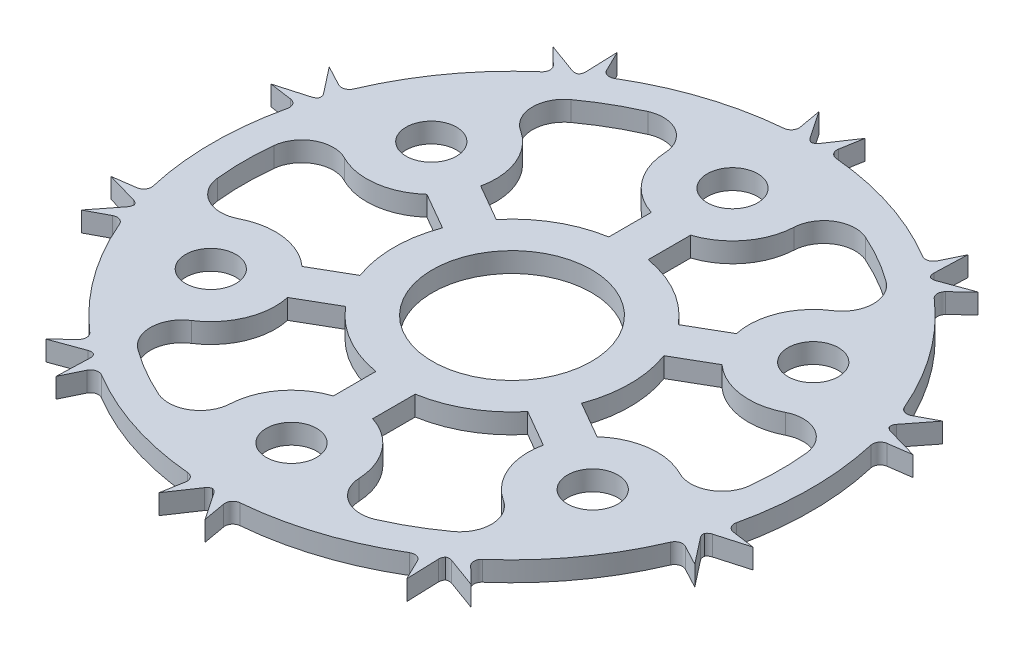
from build123d import *
from build123d.topology import SkipClean

# Parameters (mm, degrees)
SKETCH1_R                = 25.4
BOSS_EXTRUDE1_DEPTH      = 7.62
CUT_EXTRUDE4_DEPTH       = 0.635
CIRPATTERN2_COUNT        = 20
BOSS_EXTRUDE2_REACH      = 36.931
SKETCH5_R                = 3.81
SKETCH5_R_2              = 1.397
BOSS_EXTRUDE6_REACH      = 36.931
SKETCH12_R               = 3.81
SKETCH17_R               = 1.397
CUT_EXTRUDE5_DEPTH       = 33.341392346
CIRPATTERN1_COUNT        = 3
CUT_EXTRUDE7_DEPTH       = 33.67002223
SKETCH30_R               = 24.13
SKETCH30_R_2             = 21.59
BOSS_EXTRUDE16_DEPTH     = 1.6002
SKETCH31_R               = 2.032
BOSS_EXTRUDE17_DEPTH     = 1.6002
FILLET6_R                = 2.54
CIRPATTERN8_COUNT        = 6
FILLET6_OF_CIRPATTERN8_R = 2.54
BOSS_EXTRUDE18_DEPTH     = 1.6002
FILLET7_R                = 0.635
CIRPATTERN9_COUNT        = 10
FILLET7_OF_CIRPATTERN9_R = 0.635
SKETCH34_R               = 9.525
SKETCH34_R_2             = 6.4135
BOSS_EXTRUDE19_DEPTH     = 1.6002


with BuildPart() as part:
    # Sketch1 → Boss-Extrude1 (new, symmetric)
    with BuildSketch(Plane(origin=(0, 0, 0), x_dir=(1, 0, 0), z_dir=(0, 1, 0))):
        with Locations(Location((0, 0, 0), (0, 0, 90))):
            Circle(SKETCH1_R)
    extrude(amount=BOSS_EXTRUDE1_DEPTH, both=True)

    # Sketch9 → Cut-Extrude4 (cut)
    with BuildSketch(Plane.ZY.offset(25.4)):
        Polygon((-0.635, -7.62), (0.635, -7.62), (0.635, 0), (0.635, 7.62), (-0.635, 7.62), (-0.635, 0), align=None)
    cut_extrude4 = extrude(amount=-CUT_EXTRUDE4_DEPTH, mode=Mode.SUBTRACT)

    # CirPattern2: Cut-Extrude4 ×20 about axis
    cirpattern2_axis = Axis((0, 0, 0), (0, 1, 0))
    for i in range(1, CIRPATTERN2_COUNT):
        add(cut_extrude4.rotate(cirpattern2_axis, i * 360 / CIRPATTERN2_COUNT), mode=Mode.SUBTRACT)

    # Sketch4 → Cut-Revolve2 (revolve, cut)
    with BuildSketch(Plane.XY, mode=Mode.PRIVATE) as cut_revolve2_sk:
        with BuildLine():
            Line((-25.4, -7.62), (-22.225, -7.62))
            Line((-22.225, -7.62), (-22.225, -5.08))
            Line((-22.225, -5.08), (-13.94687024, -1.768748096))
            ThreePointArc((-13.94687024, -1.768748096), (-12.749369479, 0), (-13.94687024, 1.768748096))
            Line((-13.94687024, 1.768748096), (-22.225, 5.08))
            Line((-22.225, 5.08), (-22.225, 7.62))
            Line((-22.225, 7.62), (-25.4, 7.62))
            Line((-25.4, 7.62), (-25.4, -7.62))
        make_face()
    revolve(cut_revolve2_sk.sketch.rotate(Axis((0, -55, 0), (0, 1, 0)), 270), axis=Axis((0, -55, 0), (0, 1, 0)), mode=Mode.SUBTRACT)

    # Sketch5 → Boss-Extrude2 (add, up to next)
    with BuildSketch(Plane(origin=(0, 7.62, 0), x_dir=(1, 0, 0), z_dir=(0, 1, 0)), mode=Mode.PRIVATE) as boss_extrude2_sk1:
        with Locations(Location((0, 17.78, 0), (0, 0, 135.677409987))):
            Circle(SKETCH5_R)
        with Locations(Location((0, 17.78, 0), (0, 0, 168.148952206))):
            Circle(SKETCH5_R_2, mode=Mode.SUBTRACT)
    boss_extrude2_tool1 = extrude(boss_extrude2_sk1.sketch, amount=-BOSS_EXTRUDE2_REACH, mode=Mode.PRIVATE) - part.part
    boss_extrude2 = boss_extrude2_tool1.solids().sort_by_distance((2.648644, 7.62, -15.193257))[0]
    add(boss_extrude2)

    # Sketch12 → Boss-Extrude6 (add, up to next)
    with BuildSketch(Plane(origin=(0, 7.62, 0), x_dir=(1, 0, 0), z_dir=(0, 1, 0)), mode=Mode.PRIVATE) as boss_extrude6_sk1:
        with Locations(Location((-15.397931679, 8.89, 0), (0, 0, 134.328577967))):
            Circle(SKETCH12_R)
    boss_extrude6_tool1 = extrude(boss_extrude6_sk1.sketch, amount=-BOSS_EXTRUDE6_REACH, mode=Mode.PRIVATE) - part.part
    boss_extrude6 = boss_extrude6_tool1.solids().sort_by_distance((-15.397932, 7.62, -8.89))[0]
    add(boss_extrude6)

    # Sketch17 → Cut-Extrude5 (cut, symmetric)
    with BuildSketch(Plane(origin=(0, 0, 0), x_dir=(1, 0, 0), z_dir=(0, 1, 0))):
        with Locations(Location((0, 17.78, 0), (0, 0, 270))):
            Circle(SKETCH17_R)
        with Locations(Location((-15.397931679, 8.89, 0), (0, 0, 270))):
            Circle(SKETCH17_R)
        with Locations(Location((-15.397931679, -8.89, 0), (0, 0, 270))):
            Circle(SKETCH17_R)
        with BuildLine():
            Line((-18.697488468, -10.795), (-19.247414599, -11.1125))
            ThreePointArc((-19.247414599, -11.1125), (-19.247414599, 11.1125), (0, 22.225))
            Line((0, 22.225), (0, 21.59))
            ThreePointArc((0, 21.59), (-2.694076836, 20.474076836), (-3.81, 17.78))
            Line((-3.81, 17.78), (-3.81, 15.411019596))
            ThreePointArc((-3.81, 15.411019596), (-7.9375, 13.748153285), (-11.441334469, 11.005066587))
            Line((-11.441334469, 11.005066587), (-13.492931679, 12.189556788))
            ThreePointArc((-13.492931679, 12.189556788), (-18.697488468, 10.795), (-17.302931679, 5.590443212))
            Line((-17.302931679, 5.590443212), (-15.251334469, 4.40595301))
            ThreePointArc((-15.251334469, 4.40595301), (-15.875, 0), (-15.251334469, -4.40595301))
            Line((-15.251334469, -4.40595301), (-17.302931679, -5.590443212))
            ThreePointArc((-17.302931679, -5.590443212), (-19.078109077, -7.903899438), (-18.697488468, -10.795))
        make_face()
    cut_extrude5 = extrude(amount=CUT_EXTRUDE5_DEPTH, both=True, mode=Mode.SUBTRACT)

    # CirPattern1: Boss-Extrude2, Boss-Extrude6, Cut-Extrude5 ×3 about axis
    with SkipClean():  # the faces are left unmerged after this step: merging them gives an invalid solid
        cirpattern1_axis = Axis((0, 0, 0), (0, 1, 0))
        add([boss_extrude2.rotate(cirpattern1_axis, i * 360 / CIRPATTERN1_COUNT) for i in range(1, CIRPATTERN1_COUNT)])
        add([boss_extrude6.rotate(cirpattern1_axis, i * 360 / CIRPATTERN1_COUNT) for i in range(1, CIRPATTERN1_COUNT)])
        add([cut_extrude5.rotate(cirpattern1_axis, i * 360 / CIRPATTERN1_COUNT) for i in range(1, CIRPATTERN1_COUNT)], mode=Mode.SUBTRACT)

    # Sketch24 → Cut-Extrude7 (cut, through all)
    with BuildSketch(Plane.XZ.offset(7.62)):
        Polygon((5.499261314, -9.525), (10.998522628, 0), (5.499261314, 9.525), (-5.499261314, 9.525), (-10.998522628, 0), (-5.499261314, -9.525), align=None)
    extrude(amount=-CUT_EXTRUDE7_DEPTH, mode=Mode.SUBTRACT)


with BuildPart() as body_2:
    # Sketch30 → Boss-Extrude16 (new body)
    with BuildSketch(Plane.XZ.offset(7.62)):
        with Locations(Location((0, 0, 0), (0, 0, 270))):
            Circle(SKETCH30_R)
        with Locations(Location((0, 0, 0), (0, 0, 270))):
            Circle(SKETCH30_R_2, mode=Mode.SUBTRACT)
    extrude(amount=BOSS_EXTRUDE16_DEPTH)

    # Sketch31 → Boss-Extrude17 (add)
    with BuildSketch(Plane.XZ.offset(9.2202)):
        with BuildLine():
            Line((-5.207, 17.78), (-5.207, 23.561495093))
            Line((-5.207, 23.561495093), (5.207, 23.561495093))
            Line((5.207, 23.561495093), (5.207, 17.78))
            ThreePointArc((5.207, 17.78), (4.20588644, 14.710249481), (1.5875, 12.82089799))
            Line((1.5875, 12.82089799), (1.5875, 7.62))
            Line((1.5875, 7.62), (-1.5875, 7.62))
            Line((-1.5875, 7.62), (-1.5875, 12.82089799))
            ThreePointArc((-1.5875, 12.82089799), (-4.20588644, 14.710249481), (-5.207, 17.78))
        make_face()
        with Locations(Location((0, 17.78, 0), (0, 0, 270))):
            Circle(SKETCH31_R, mode=Mode.SUBTRACT)
    boss_extrude17 = extrude(amount=-BOSS_EXTRUDE17_DEPTH)

    # Fillet6
    fillet6_edges = [body_2.edges().sort_by_distance(p)[0] for p in [
        (5.207, -8.4201, 20.952690782),
        (-5.207, -8.4201, 20.952690782),
    ]]
    fillet(fillet6_edges, radius=FILLET6_R)

    # CirPattern8: Boss-Extrude17 ×6 about axis
    cirpattern8_axis = Axis((0, 0, 0), (0, 1, 0))
    for i in range(1, CIRPATTERN8_COUNT):
        add(boss_extrude17.rotate(cirpattern8_axis, i * 360 / CIRPATTERN8_COUNT))

    # Fillet6 of CirPattern8
    fillet6_of_cirpattern8_edges = [body_2.edges().sort_by_distance(p)[0] for p in [
        (20.749062495, -8.4201, 5.966951113),
        (15.542062495, -8.4201, 14.985739668),
        (15.542062495, -8.4201, -14.985739668),
        (20.749062495, -8.4201, -5.966951113),
        (-5.207, -8.4201, -20.952690782),
        (5.207, -8.4201, -20.952690782),
        (-20.749062495, -8.4201, -5.966951113),
        (-15.542062495, -8.4201, -14.985739668),
        (-15.542062495, -8.4201, 14.985739668),
        (-20.749062495, -8.4201, 5.966951113),
    ]]
    fillet(fillet6_of_cirpattern8_edges, radius=FILLET6_OF_CIRPATTERN8_R)

    # Sketch32 → Boss-Extrude18 (add)
    with BuildSketch(Plane.XZ.offset(9.2202)):
        Polygon((1.860405155, 26.60503322), (0.190467123, 24.129248274), (1.416651103, 24.088378934), align=None)
        Polygon((-1.416651103, 24.088378934), (-1.860405155, 26.60503322), (-0.190467123, 24.129248274), align=None)
    boss_extrude18 = extrude(amount=-BOSS_EXTRUDE18_DEPTH)

    # Fillet7
    # the kernel refuses this fillet: 0.635 mm, written as the material it adds along each edge
    with BuildSketch(Plane(origin=(-0.190467123, -9.2202, 24.129248274), x_dir=(0.9999995200817018, 0, 0.0009797123894977819), z_dir=(0, 1, 0))) as fillet7_piece_1:
        with BuildLine():
            CenterArc((0.338044808, -0.634984824), FILLET7_R, 90.396128338, 55.660005056)
            Line((-0.188741682, -0.280413259), (0, 0))
            ThreePointArc((0, 0), (0.166827308, -0.000576703), (0.333654615, 0))
        make_face()
    extrude(amount=1.6002)
    with BuildSketch(Plane(origin=(-1.416651103, -9.2202, 24.088378934), x_dir=(-0.9973280009375803, 0, -0.07305380582727858), z_dir=(0, 1, 0))) as fillet7_piece_2:
        with BuildLine():
            CenterArc((0.702892362, 0.634934383), FILLET7_R, 174.18940678, 94.986906687)
            Line((0.071154987, 0.699221933), (0, 0))
            ThreePointArc((0, 0), (0.346881945, 0.002493438), (0.69376389, 0))
        make_face()
    extrude(amount=1.6002)
    with BuildSketch(Plane(origin=(1.416651103, -9.2202, 24.088378934), x_dir=(0.9973280009375803, 0, -0.07305380582727927), z_dir=(0, 1, 0))) as fillet7_piece_3:
        with BuildLine():
            CenterArc((0.702892362, -0.634934383), FILLET7_R, 90.823686533, 94.986906687)
            Line((0.071154987, -0.699221933), (0, 0))
            ThreePointArc((0, 0), (0.346881945, -0.002493438), (0.69376389, 0))
        make_face()
    extrude(amount=1.6002)
    with BuildSketch(Plane(origin=(0.190467123, -9.2202, 24.129248274), x_dir=(-0.9999995200817018, 0, 0.0009797123894977626), z_dir=(0, 1, 0))) as fillet7_piece_4:
        with BuildLine():
            CenterArc((0.338044808, 0.634984824), FILLET7_R, 213.943866606, 55.660005056)
            Line((-0.188741682, 0.280413259), (0, 0))
            ThreePointArc((0, 0), (0.166827308, 0.000576703), (0.333654615, 0))
        make_face()
    extrude(amount=1.6002)

    # CirPattern9: Boss-Extrude18 ×10 about axis
    cirpattern9_axis = Axis((0, 0, 0), (0, 1, 0))
    for i in range(1, CIRPATTERN9_COUNT):
        add(boss_extrude18.rotate(cirpattern9_axis, i * 360 / CIRPATTERN9_COUNT))

    # Fillet7 of CirPattern9
    # the kernel refuses this fillet: 0.635 mm, written as the material it adds along each edge
    with BuildSketch(Plane(origin=(14.028725145, -9.2202, 19.632925681), x_dir=(0.03489949670250677, 0, 0.9993908270190954), z_dir=(0, 1, 0)), Plane(origin=(22.889421227, -9.2202, 7.637492776), x_dir=(0.615661475325664, 0, 0.7880107536067176), z_dir=(0, 1, 0)), Plane(origin=(23.007136382, -9.2202, -7.27520278), x_dir=(0.9612616959383196, 0, 0.27563735581699683), z_dir=(0, 1, 0)), Plane(origin=(14.336907424, -9.2202, -19.40901815), x_dir=(0.9396926207859054, 0, -0.34202014332567665), z_dir=(0, 1, 0)), Plane(origin=(0.190467123, -9.2202, -24.129248274), x_dir=(0.559192903470741, 0, -0.8290375725550456), z_dir=(0, 1, 0)), Plane(origin=(-14.028725145, -9.2202, -19.632925681), x_dir=(-0.03489949670250263, 0, -0.9993908270190958), z_dir=(0, 1, 0)), Plane(origin=(-22.889421227, -9.2202, -7.637492776), x_dir=(-0.6156614753256622, 0, -0.7880107536067188), z_dir=(0, 1, 0)), Plane(origin=(-23.007136382, -9.2202, 7.27520278), x_dir=(-0.9612616959383196, 0, -0.27563735581699694), z_dir=(0, 1, 0))) as fillet7_of_cirpattern9_piece_1:
        with BuildLine():
            CenterArc((0.338016299, 0.635), FILLET7_OF_CIRPATTERN9_R, 214.339994944, 55.660005056)
            ThreePointArc((-0.186306203, 0.276794872), (-0.092674677, 0.138719456), (0, 0))
            Line((0, 0), (0.338016299, 0))
        make_face()
    extrude(amount=1.6002)
    with BuildSketch(Plane(origin=(13.012699072, -9.2202, 20.32059455), x_dir=(-0.8497952514136049, 0, 0.527112920231413), z_dir=(0, 1, 0)), Plane(origin=(22.471640486, -9.2202, 8.79103372), x_dir=(-0.37766959932788574, 0, 0.9259404266709139), z_dir=(0, 1, 0)), Plane(origin=(23.347179018, -9.2202, -6.096403195), x_dir=(0.23871300318352556, 0, 0.9710901616796981), z_dir=(0, 1, 0)), Plane(origin=(15.304888706, -9.2202, -18.655221298), x_dir=(0.7639153520353841, 0, 0.6453164610674791), z_dir=(0, 1, 0)), Plane(origin=(1.416651103, -9.2202, -24.088378934), x_dir=(0.9973280009375805, 0, 0.07305380582727697), z_dir=(0, 1, 0)), Plane(origin=(-13.012699072, -9.2202, -20.32059455), x_dir=(0.8497952514136128, 0, -0.5271129202314003), z_dir=(0, 1, 0)), Plane(origin=(-22.471640486, -9.2202, -8.79103372), x_dir=(0.37766959932791355, 0, -0.9259404266709027), z_dir=(0, 1, 0)), Plane(origin=(-23.347179018, -9.2202, 6.096403195), x_dir=(-0.23871300318349162, 0, -0.9710901616797064), z_dir=(0, 1, 0)), Plane(origin=(-15.304888706, -9.2202, 18.655221298), x_dir=(-0.7639153520353762, 0, -0.6453164610674884), z_dir=(0, 1, 0))) as fillet7_of_cirpattern9_piece_2:
        with BuildLine():
            CenterArc((0.702892362, 0.634934383), FILLET7_OF_CIRPATTERN9_R, 174.18940678, 94.986906687)
            Line((0.071154987, 0.699221933), (0, 0))
            ThreePointArc((0, 0), (0.346881945, 0.002493438), (0.69376389, 0))
        make_face()
    extrude(amount=1.6002)
    with BuildSketch(Plane(origin=(15.304888706, -9.2202, 18.655221298), x_dir=(0.7193398003386516, 0, 0.6946583704589967), z_dir=(0, 1, 0)), Plane(origin=(23.347179018, -9.2202, 6.096403195), x_dir=(0.9902680687415706, 0, 0.13917310096006394), z_dir=(0, 1, 0)), Plane(origin=(22.471640486, -9.2202, -8.79103372), x_dir=(0.8829475928589268, 0, -0.46947156278589125), z_dir=(0, 1, 0)), Plane(origin=(13.012699072, -9.2202, -20.32059455), x_dir=(0.4383711467890756, 0, -0.8987940462991678), z_dir=(0, 1, 0)), Plane(origin=(-1.416651103, -9.2202, -24.088378934), x_dir=(-0.17364817766693175, 0, -0.9848077530122078), z_dir=(0, 1, 0)), Plane(origin=(-15.304888706, -9.2202, -18.655221298), x_dir=(-0.7193398003386523, 0, -0.6946583704589961), z_dir=(0, 1, 0)), Plane(origin=(-23.347179018, -9.2202, -6.096403195), x_dir=(-0.9902680687415706, 0, -0.13917310096006316), z_dir=(0, 1, 0)), Plane(origin=(-22.471640486, -9.2202, 8.79103372), x_dir=(-0.8829475928589264, 0, 0.46947156278589175), z_dir=(0, 1, 0))) as fillet7_of_cirpattern9_piece_3:
        with BuildLine():
            CenterArc((0.702833084, 0.635), FILLET7_OF_CIRPATTERN9_R, 175.013093313, 94.986906687)
            ThreePointArc((0.07023682, 0.690199336), (0.037599036, 0.344847232), (0, 0))
            Line((0, 0), (0.702833084, 0))
        make_face()
    extrude(amount=1.6002)
    with BuildSketch(Plane(origin=(14.336907424, -9.2202, 19.40901815), x_dir=(-0.8084407456188444, 0, 0.5885775741762905), z_dir=(0, 1, 0)), Plane(origin=(23.007136382, -9.2202, 7.27520278), x_dir=(-0.3080850842198965, 0, 0.9513588076436879), z_dir=(0, 1, 0)), Plane(origin=(22.889421227, -9.2202, -7.637492776), x_dir=(0.30994860792420126, 0, 0.9507533120877623), z_dir=(0, 1, 0)), Plane(origin=(14.028725145, -9.2202, -19.632925681), x_dir=(0.8095924666069352, 0, 0.5869923662308553), z_dir=(0, 1, 0)), Plane(origin=(-0.190467123, -9.2202, -24.129248274), x_dir=(0.9999995200817018, 0, -0.000979712389497761), z_dir=(0, 1, 0)), Plane(origin=(-14.336907424, -9.2202, -19.40901815), x_dir=(0.8084407456188637, 0, -0.588577574176264), z_dir=(0, 1, 0)), Plane(origin=(-23.007136382, -9.2202, -7.27520278), x_dir=(0.30808508421995306, 0, -0.9513588076436695), z_dir=(0, 1, 0)), Plane(origin=(-22.889421227, -9.2202, 7.637492776), x_dir=(-0.30994860792414214, 0, -0.9507533120877815), z_dir=(0, 1, 0)), Plane(origin=(-14.028725145, -9.2202, 19.632925681), x_dir=(-0.8095924666069085, 0, -0.5869923662308921), z_dir=(0, 1, 0))) as fillet7_of_cirpattern9_piece_4:
        with BuildLine():
            CenterArc((0.338044808, 0.634984824), FILLET7_OF_CIRPATTERN9_R, 213.943866606, 55.660005056)
            Line((-0.188741682, 0.280413259), (0, 0))
            ThreePointArc((0, 0), (0.166827308, 0.000576703), (0.333654615, 0))
        make_face()
    extrude(amount=1.6002)
    with BuildSketch(Plane(origin=(-14.336907424, -9.2202, 19.40901815), x_dir=(0.8084407456188606, 0, 0.5885775741762684), z_dir=(0, 1, 0))) as fillet7_of_cirpattern9_piece_5:
        with BuildLine():
            CenterArc((0.338044808, -0.634984824), FILLET7_OF_CIRPATTERN9_R, 90.396128338, 55.660005056)
            Line((-0.188741682, -0.280413259), (0, 0))
            ThreePointArc((0, 0), (0.166827308, -0.000576703), (0.333654615, 0))
        make_face()
    extrude(amount=1.6002)
    with BuildSketch(Plane(origin=(-13.012699072, -9.2202, 20.32059455), x_dir=(0.8497952514136161, 0, 0.5271129202313952), z_dir=(0, 1, 0))) as fillet7_of_cirpattern9_piece_6:
        with BuildLine():
            CenterArc((0.702892362, -0.634934383), FILLET7_OF_CIRPATTERN9_R, 90.823686533, 94.986906687)
            Line((0.071154987, -0.699221933), (0, 0))
            ThreePointArc((0, 0), (0.346881945, -0.002493438), (0.69376389, 0))
        make_face()
    extrude(amount=1.6002)

    # Sketch34 → Boss-Extrude19 (add)
    with BuildSketch(Plane.XZ.offset(9.2202)):
        Circle(SKETCH34_R)
        with Locations(Location((0, 0, 0), (0, 0, 270))):
            Circle(SKETCH34_R_2, mode=Mode.SUBTRACT)
    extrude(amount=-BOSS_EXTRUDE19_DEPTH)


solid = body_2.part
